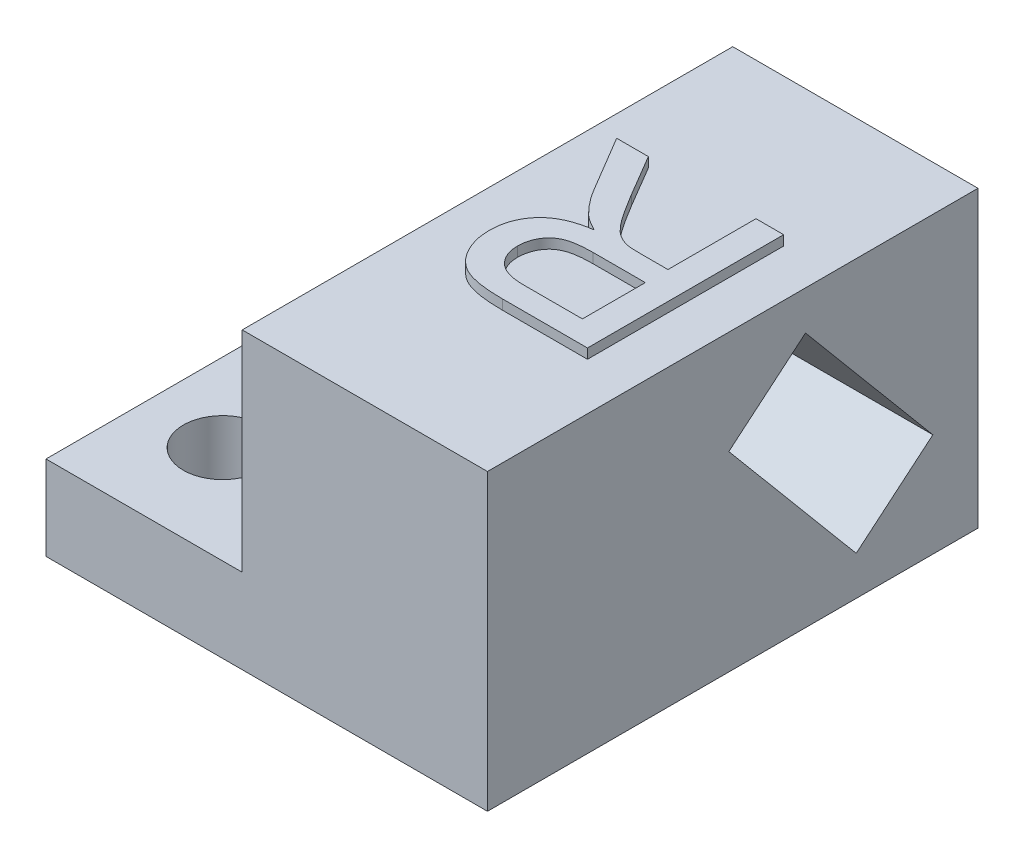
from build123d import *

# Parameters (mm, degrees)
SKETCH1_W           = 25
SKETCH1_H           = 50
BOSS_EXTRUDE1_DEPTH = 30
SKETCH2_W           = 50
SKETCH2_H           = 8.605036789
BOSS_EXTRUDE2_DEPTH = 20
SKETCH3_R           = 4
CUT_EXTRUDE1_DEPTH  = 47.249264327
CUT_EXTRUDE2_DEPTH  = 20
BOSS_EXTRUDE3_DEPTH = 1


with BuildPart() as part:
    # Sketch1 → Boss-Extrude1 (new body)
    with BuildSketch(Plane(origin=(0, 0, 0), x_dir=(1, 0, 0), z_dir=(0, 1, 0))):
        Rectangle(SKETCH1_W, SKETCH1_H)
    extrude(amount=BOSS_EXTRUDE1_DEPTH)

    # Sketch2 → Boss-Extrude2 (add)
    with BuildSketch(Plane.ZY.offset(12.5)):
        with Locations((0, 4.302518394)):
            Rectangle(SKETCH2_W, SKETCH2_H)
    extrude(amount=BOSS_EXTRUDE2_DEPTH)

    # Sketch3 → Cut-Extrude1 (cut, through all)
    with BuildSketch(Plane(origin=(0, 8.605036789, 0), x_dir=(1, 0, 0), z_dir=(0, 1, 0))):
        with Locations((-24.5, 15)):
            Circle(SKETCH3_R)
        with Locations((-24.5, -15)):
            Circle(SKETCH3_R)
    extrude(amount=-CUT_EXTRUDE1_DEPTH, mode=Mode.SUBTRACT)

    # Sketch4 → Cut-Extrude2 (cut)
    with BuildSketch(Plane(origin=(12.5, 0, 0), x_dir=(0, 0, -1), z_dir=(1, 0, 0))):
        Polygon((7.414671802, 26.015265685), (20.398981518, 10.541167934), (12.585328198, 3.984734315), (-0.398981518, 19.458832066), align=None)
    extrude(amount=-CUT_EXTRUDE2_DEPTH, mode=Mode.SUBTRACT)

    # Sketch5 → Boss-Extrude3 (add)
    with BuildSketch(Plane(origin=(0, 30, 0), x_dir=(1, 0, 0), z_dir=(0, 1, 0))):
        with BuildLine():
            Line((7.692307692, 10), (7.692307692, -10))
            Line((7.692307692, -10), (-0.985576923, -10))
            add(Edge.make_bspline(
                [(-0.985576923, -10), (-1.189915508, -9.998406517), (-1.585388921, -9.995322517), (-2.158891161, -9.97328499), (-2.692933181, -9.926466249), (-3.190880742, -9.87417544), (-3.651881782, -9.796967041), (-4.076156001, -9.706387661), (-4.462076213, -9.599333368), (-4.812578849, -9.472790754), (-5.13779529, -9.329673653), (-5.439160579, -9.1529927), (-5.729614752, -8.959721513), (-5.997579665, -8.730765608), (-6.255124362, -8.484777239), (-6.491466209, -8.20944831), (-6.713599726, -7.911670049), (-6.98368474, -7.480457665), (-7.26734754, -6.902448182), (-7.511671117, -6.168093018), (-7.667028651, -5.399134972), (-7.683798939, -4.873873893), (-7.692307692, -4.607371795)],
                knots=[0, 0, 0, 0, 1.242075696, 2.40389213, 3.487198984, 4.500157661, 5.446319301, 6.326791195, 7.136300648, 7.878370406, 8.590488565, 9.292260633, 9.999224673, 10.708050372, 11.431369221, 12.162165018, 12.910600795, 13.687589445, 15.252257874, 16.810406251, 18.381693487, 20, 20, 20, 20], degree=3))
            add(Edge.make_bspline(
                [(-7.692307692, -4.607371795), (-7.688394011, -4.436288612), (-7.680664221, -4.098387595), (-7.621454116, -3.601582104), (-7.51431592, -3.126906532), (-7.376939813, -2.670193942), (-7.1888858, -2.237951011), (-6.971132957, -1.821215885), (-6.700987613, -1.431932834), (-6.399355855, -1.057091635), (-6.048612719, -0.71360816), (-5.658467411, -0.39614679), (-5.217190586, -0.123711561), (-4.739255324, 0.129469087), (-4.212344466, 0.337396306), (-3.644404331, 0.520482963), (-3.031039376, 0.661647942), (-2.605906991, 0.732754289), (-2.387820513, 0.769230769)],
                knots=[0, 0, 0, 0, 0.982645791, 1.940792824, 2.867691729, 3.775150443, 4.675643875, 5.571354211, 6.471357401, 7.392684514, 8.331098131, 9.285922955, 10.275520706, 11.304845665, 12.388884831, 13.524255008, 14.729980297, 16, 16, 16, 16], degree=3))
            add(Edge.make_bspline(
                [(-2.387820513, 0.769230769), (-2.549345996, 0.849743746), (-2.855664626, 1.002429402), (-3.272498706, 1.255059029), (-3.637663897, 1.492888205), (-3.845092801, 1.671226556), (-3.942307692, 1.754807692)],
                knots=[0, 0, 0, 0, 1.172551213, 2.223638478, 3.167479604, 4, 4, 4, 4], degree=3))
            add(Edge.make_bspline(
                [(-3.942307692, 1.754807692), (-4.131560958, 1.939760877), (-4.519688241, 2.319069404), (-5.049338611, 2.971134565), (-5.573421338, 3.688219618), (-5.888069662, 4.2107727), (-6.049679487, 4.479166667)],
                knots=[0, 0, 0, 0, 0.918170575, 1.883016652, 2.912673989, 4, 4, 4, 4], degree=3))
            Line((-6.049679487, 4.479166667), (-9.330929487, 10))
            Line((-9.330929487, 10), (-6.09775641, 10))
            Line((-6.09775641, 10), (-3.605769231, 5.77724359))
            add(Edge.make_bspline(
                [(-3.605769231, 5.77724359), (-3.516164402, 5.629086783), (-3.342524957, 5.34198322), (-3.091798881, 4.922621923), (-2.845639404, 4.536751784), (-2.618440056, 4.172360633), (-2.395792195, 3.839058208), (-2.196203285, 3.524230537), (-1.99576396, 3.245712753), (-1.765615132, 2.91110533), (-1.484546035, 2.549334189), (-1.156558274, 2.177690005), (-0.854995349, 1.869836465), (-0.473923576, 1.576103263), (-8.0808e-05, 1.307161834), (0.399436219, 1.179583217), (0.592948718, 1.117788462)],
                knots=[0, 0, 0, 0, 1.130591283, 2.190900266, 3.190104209, 4.119071823, 4.994606968, 5.807262858, 6.55236009, 7.234593472, 8.459046683, 9.540234366, 10.471327768, 11.266723835, 12.676093724, 14, 14, 14, 14], degree=3))
            add(Edge.make_bspline(
                [(0.592948718, 1.117788462), (0.674242958, 1.103128347), (0.859840146, 1.069658866), (1.174983707, 1.047799895), (1.556818794, 1.024599522), (1.833541189, 1.025275503), (1.983173077, 1.025641026)],
                knots=[0, 0, 0, 0, 0.709978628, 1.620902492, 2.713552433, 4, 4, 4, 4], degree=3))
            Line((1.983173077, 1.025641026), (4.871794872, 1.025641026))
            Line((4.871794872, 1.025641026), (4.871794872, 10))
            Line((4.871794872, 10), (7.692307692, 10))
        make_face()
        with BuildLine():
            Line((4.871794872, -1.282051282), (-0.484775641, -1.282051282))
            add(Edge.make_bspline(
                [(-0.484775641, -1.282051282), (-0.753386517, -1.286217416), (-1.255529355, -1.294005613), (-1.957518176, -1.361528247), (-2.558000395, -1.467075801), (-3.064646298, -1.627384754), (-3.490432782, -1.842070076), (-3.859462924, -2.104609449), (-4.169752828, -2.430321342), (-4.424939479, -2.80379836), (-4.624425797, -3.210810832), (-4.763816724, -3.641583566), (-4.857398907, -4.087856282), (-4.866967535, -4.393220511), (-4.871794872, -4.547275641)],
                knots=[0, 0, 0, 0, 1.546056516, 2.890207646, 4.055830773, 5.050253158, 5.937355789, 6.790906573, 7.644595853, 8.512568064, 9.38593768, 10.244184789, 11.114197691, 12, 12, 12, 12], degree=3))
            add(Edge.make_bspline(
                [(-4.871794872, -4.547275641), (-4.868088958, -4.659544766), (-4.86083016, -4.879447), (-4.822372143, -5.202097101), (-4.749202425, -5.50786025), (-4.648165007, -5.798940542), (-4.520236894, -6.075969951), (-4.363033481, -6.337858904), (-4.177365929, -6.583269781), (-3.964383478, -6.81341075), (-3.719926868, -7.02284832), (-3.440676061, -7.203538998), (-3.128860999, -7.357089463), (-2.784111469, -7.478956731), (-2.407515729, -7.576430897), (-1.996929252, -7.641277267), (-1.554229928, -7.688199899), (-1.24746496, -7.690912847), (-1.08974359, -7.692307692)],
                knots=[0, 0, 0, 0, 0.965235723, 1.89061323, 2.787065514, 3.661873922, 4.534873316, 5.404925039, 6.281839248, 7.175200054, 8.095223355, 9.040740021, 10.02630299, 11.075573487, 12.177989335, 13.364883635, 14.645170704, 16, 16, 16, 16], degree=3))
            Line((-1.08974359, -7.692307692), (4.871794872, -7.692307692))
            Line((4.871794872, -7.692307692), (4.871794872, -1.282051282))
        make_face(mode=Mode.SUBTRACT)
    extrude(amount=BOSS_EXTRUDE3_DEPTH)


solid = part.part
